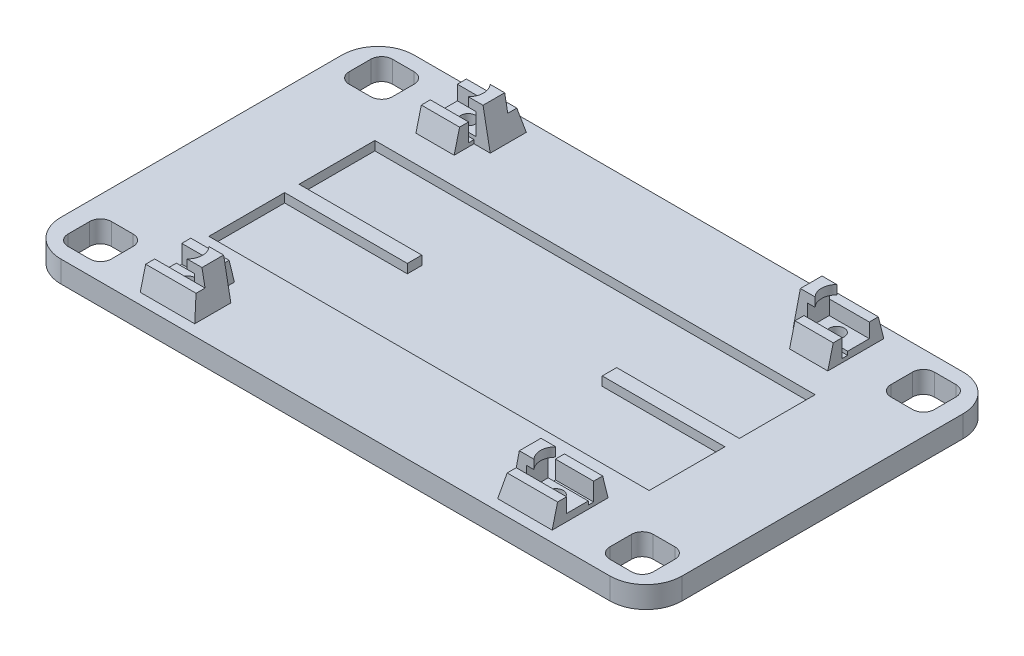
from build123d import *

# Parameters (mm, degrees)
SKETCH1_W                        = 34.5
SKETCH1_H                        = 8.741142107
BOSS_EXTRUDE3_DEPTH              = 6
SKETCH6_W                        = 11
SKETCH6_H                        = 11
BOSS_EXTRUDE4_DEPTH              = 2
CUT_EXTRUDE1_START               = -3
CUT_EXTRUDE1_DEPTH               = 24
SKETCH7_W                        = 11
SKETCH7_H                        = 2.5
SKETCH7_H_2                      = 1
BOSS_EXTRUDE5_DEPTH              = 4
SKETCH10_W                       = 3.083691557
SKETCH10_H                       = 13.597950321
CUT_EXTRUDE2_DEPTH               = 12
SKETCH11_W                       = 10.179154034
SKETCH11_H                       = 1.5
BOSS_EXTRUDE7_DEPTH              = 6
SKETCH12_W                       = 2.5
SKETCH12_H                       = 12.5
BOSS_EXTRUDE8_DEPTH              = 6
BOSS_EXTRUDE9_DEPTH              = 11.6
SKETCH21_R                       = 4.5
CUT_EXTRUDE9_DEPTH               = 3
CUT_EXTRUDE11_DEPTH              = 11.5
BOSS_EXTRUDE14_DEPTH             = 6
CUT_EXTRUDE12_START              = -1
SKETCH28_W                       = 13.111544153
SKETCH28_H                       = 1.5
CUT_EXTRUDE12_DEPTH              = 11
BOSS_EXTRUDE15_DEPTH             = 1.5
SKETCH30_W                       = 2.5
SKETCH30_H                       = 6
BOSS_EXTRUDE16_DEPTH             = 2
SKETCH31_W                       = 2.5
SKETCH31_H                       = 6
BOSS_EXTRUDE17_DEPTH             = 2.5
BOSS_EXTRUDE18_REACH             = 128.051
BOSS_EXTRUDE18_DIRECTION_2_REACH = 128.051
SKETCH34_W                       = 17.603907028
SKETCH34_H                       = 5.411961877
SKETCH34_H_2                     = 6.558600434
CUT_EXTRUDE13_DEPTH              = 4.5
BOSS_EXTRUDE20_DEPTH             = 11.6
MIRROR11_OUTLINE_R               = 2.069860115
MIRROR11_DEPTH                   = 6
MIRROR11_2_OUTLINE_R             = 4.5
MIRROR11_2_OUTLINE_R_2           = 2.069860115
MIRROR11_2_DEPTH                 = 3
MIRROR11_START                   = 6
MIRROR11_3_OUTLINE_R             = 2.069860115
MIRROR11_3_DEPTH                 = 2
MIRROR11_START_2                 = 8
MIRROR11_4_DEPTH                 = 4
MIRROR11_5_OUTLINE_W             = 13.1
MIRROR11_5_OUTLINE_H             = 1.5
MIRROR11_5_DEPTH                 = 1
MIRROR11_START_3                 = 14
MIRROR11_6_DEPTH                 = 2.5
MIRROR11_START_4                 = -59.844904725
MIRROR11_7_OUTLINE_W             = 6
MIRROR11_7_OUTLINE_H             = 2.5
MIRROR11_7_DEPTH                 = 15.1
MIRROR11_START_5                 = -49.244904725
MIRROR11_8_OUTLINE_W             = 10.5
MIRROR11_8_OUTLINE_H             = 6
MIRROR11_8_DEPTH                 = 4.5
MIRROR11_START_6                 = -46.744904725
MIRROR11_9_OUTLINE_W             = 6
MIRROR11_9_OUTLINE_H             = 1.5
MIRROR11_9_DEPTH                 = 2
MIRROR11_10_DEPTH                = 1.5
MIRROR11_START_7                 = -42.831972915
MIRROR11_11_DEPTH                = 2.831972915
BOSS_EXTRUDE21_DEPTH             = 11.6
CUT_EXTRUDE14_START              = -5
SKETCH37_W                       = 89.881860183
SKETCH37_H                       = 1.5
SKETCH37_W_2                     = 87.938782422
CUT_EXTRUDE14_DEPTH              = 5
SKETCH39_W                       = 7.636808492
SKETCH39_H                       = 7.005250269
CUT_EXTRUDE18_DEPTH              = 6
MIRROR13_COPY_1_SKETCH_W         = 7.636808492
MIRROR13_COPY_1_SKETCH_H         = 7.005250269
MIRROR13_COPY_1_DEPTH            = 6
SKETCH41_W                       = 6
SKETCH41_H                       = 6
CUT_EXTRUDE20_DEPTH              = 0.5
SKETCH42_W                       = 122
SKETCH42_H                       = 46
CUT_EXTRUDE21_DEPTH              = 1
SKETCH43_W                       = 24
SKETCH43_H                       = 2
BOSS_EXTRUDE23_DEPTH             = 1
SKETCH44_W                       = 4
SKETCH44_H                       = 17
CUT_EXTRUDE22_DEPTH              = 1.5
SKETCH45_W                       = 16
SKETCH45_H                       = 17
CUT_EXTRUDE23_DEPTH              = 1
SKETCH46_W                       = 58
SKETCH46_H                       = 37
SKETCH46_W_2                     = 54
SKETCH46_H_2                     = 33
BOSS_EXTRUDE25_DEPTH             = 1
SKETCH47_W                       = 54
SKETCH47_H                       = 12
CUT_EXTRUDE24_DEPTH              = 1.5
SKETCH48_W                       = 4
SKETCH48_H                       = 17
CUT_EXTRUDE25_DEPTH              = 1.5
SKETCH49_W                       = 4
SKETCH49_H                       = 17
CUT_EXTRUDE26_DEPTH              = 0.5
SKETCH50_W                       = 4
SKETCH50_H                       = 2
BOSS_EXTRUDE26_DEPTH             = 1
SKETCH51_W                       = 122
SKETCH51_H                       = 46
CUT_EXTRUDE27_DEPTH              = 110
SKETCH52_W                       = 34.00000312
SKETCH52_H                       = 3.99999256
BOSS_EXTRUDE27_DEPTH             = 2.5


with BuildPart() as part:
    # Sketch1 → Boss-Extrude3 (new body)
    # profile 1 of 11: a face of its own
    with BuildSketch(Plane(origin=(0, 0, 0), x_dir=(1, 0, 0), z_dir=(0, 1, 0))):
        with BuildLine():
            Line((73.923306644, 42.779769086), (-59.063365063, 42.779769086))
            ThreePointArc((-59.063365063, 42.779769086), (-65.244285922, 40.219547838), (-67.804507169, 34.03862698))
            Line((-67.804507169, 34.03862698), (-67.804507169, -34.03862698))
            ThreePointArc((-67.804507169, -34.03862698), (-65.244285922, -40.219547838), (-59.063365063, -42.779769086))
            Line((-59.063365063, -42.779769086), (73.923306644, -42.779769086))
            ThreePointArc((73.923306644, -42.779769086), (80.104227503, -40.219547838), (82.664448751, -34.03862698))
            Line((82.664448751, -34.03862698), (82.664448751, 34.03862698))
            ThreePointArc((82.664448751, 34.03862698), (80.104227503, 40.219547838), (73.923306644, 42.779769086))
        make_face()
        with Locations((61.043877697, 34.03862698)):
            Rectangle(SKETCH1_W, SKETCH1_H, mode=Mode.SUBTRACT)
    # profile 2 of 11: a face of its own
    with BuildSketch(Plane(origin=(0, 0, 0), x_dir=(1, 0, 0), z_dir=(0, 1, 0))):
        with BuildLine():
            Line((78.293877697, 29.668055926), (78.293877697, 34.03862698))
            Line((78.293877697, 34.03862698), (74.273170351, 34.03862698))
            ThreePointArc((74.273170351, 34.03862698), (72.293877697, 32.059334326), (70.314585044, 34.03862698))
            Line((70.314585044, 34.03862698), (50.363737812, 34.03862698))
            ThreePointArc((50.363737812, 34.03862698), (48.293877697, 31.968766864), (46.224017582, 34.03862698))
            Line((46.224017582, 34.03862698), (43.793877697, 34.03862698))
            Line((43.793877697, 34.03862698), (43.793877697, 29.668055926))
            Line((43.793877697, 29.668055926), (78.293877697, 29.668055926))
        make_face()
    # profile 3 of 11: a face of its own
    with BuildSketch(Plane(origin=(0, 0, 0), x_dir=(1, 0, 0), z_dir=(0, 1, 0))):
        with BuildLine():
            Line((78.293877697, 34.03862698), (78.293877697, 38.409198033))
            Line((78.293877697, 38.409198033), (43.793877697, 38.409198033))
            Line((43.793877697, 38.409198033), (43.793877697, 34.03862698))
            Line((43.793877697, 34.03862698), (46.224017582, 34.03862698))
            ThreePointArc((46.224017582, 34.03862698), (48.293877697, 36.108487095), (50.363737812, 34.03862698))
            Line((50.363737812, 34.03862698), (70.314585044, 34.03862698))
            ThreePointArc((70.314585044, 34.03862698), (72.293877697, 36.017919633), (74.273170351, 34.03862698))
            Line((74.273170351, 34.03862698), (78.293877697, 34.03862698))
        make_face()
    # profile 4 of 11: a face of its own
    with BuildSketch(Plane(origin=(0, 0, 0), x_dir=(1, 0, 0), z_dir=(0, 1, 0))):
        with BuildLine():
            ThreePointArc((70.314585044, 34.03862698), (72.293877697, 32.059334326), (74.273170351, 34.03862698))
            Line((74.273170351, 34.03862698), (70.314585044, 34.03862698))
        make_face()
    # profile 5 of 11: a face of its own
    with BuildSketch(Plane(origin=(0, 0, 0), x_dir=(1, 0, 0), z_dir=(0, 1, 0))):
        with BuildLine():
            Line((70.314585044, 34.03862698), (74.273170351, 34.03862698))
            ThreePointArc((74.273170351, 34.03862698), (72.293877697, 36.017919633), (70.314585044, 34.03862698))
        make_face()
    # profile 6 of 11: a face of its own
    with BuildSketch(Plane(origin=(0, 0, 0), x_dir=(1, 0, 0), z_dir=(0, 1, 0))):
        with BuildLine():
            ThreePointArc((70.314585044, 34.03862698), (72.293877697, 32.059334326), (74.273170351, 34.03862698))
            Line((74.273170351, 34.03862698), (70.314585044, 34.03862698))
        make_face()
    # profile 7 of 11: a face of its own
    with BuildSketch(Plane(origin=(0, 0, 0), x_dir=(1, 0, 0), z_dir=(0, 1, 0))):
        with BuildLine():
            Line((70.314585044, 34.03862698), (74.273170351, 34.03862698))
            ThreePointArc((74.273170351, 34.03862698), (72.293877697, 36.017919633), (70.314585044, 34.03862698))
        make_face()
    # profile 8 of 11: a face of its own
    with BuildSketch(Plane(origin=(0, 0, 0), x_dir=(1, 0, 0), z_dir=(0, 1, 0))):
        with BuildLine():
            ThreePointArc((50.363737812, 34.03862698), (48.293877697, 36.108487095), (46.224017582, 34.03862698))
            Line((46.224017582, 34.03862698), (50.363737812, 34.03862698))
        make_face()
    # profile 9 of 11: a face of its own
    with BuildSketch(Plane(origin=(0, 0, 0), x_dir=(1, 0, 0), z_dir=(0, 1, 0))):
        with BuildLine():
            Line((50.363737812, 34.03862698), (46.224017582, 34.03862698))
            ThreePointArc((46.224017582, 34.03862698), (48.293877697, 31.968766864), (50.363737812, 34.03862698))
        make_face()
    # profile 10 of 11: a face of its own
    with BuildSketch(Plane(origin=(0, 0, 0), x_dir=(1, 0, 0), z_dir=(0, 1, 0))):
        with BuildLine():
            ThreePointArc((50.363737812, 34.03862698), (48.293877697, 36.108487095), (46.224017582, 34.03862698))
            Line((46.224017582, 34.03862698), (50.363737812, 34.03862698))
        make_face()
    # profile 11 of 11: a face of its own
    with BuildSketch(Plane(origin=(0, 0, 0), x_dir=(1, 0, 0), z_dir=(0, 1, 0))):
        with BuildLine():
            Line((50.363737812, 34.03862698), (46.224017582, 34.03862698))
            ThreePointArc((46.224017582, 34.03862698), (48.293877697, 31.968766864), (50.363737812, 34.03862698))
        make_face()
    extrude(amount=BOSS_EXTRUDE3_DEPTH)

    # Sketch6 → Boss-Extrude4 (add)
    with BuildSketch(Plane(origin=(0, 6, 0), x_dir=(1, 0, 0), z_dir=(0, 1, 0))):
        with Locations((48.114723663, 34.03862698)):
            Rectangle(SKETCH6_W, SKETCH6_H)
    boss_extrude4 = extrude(amount=BOSS_EXTRUDE4_DEPTH)

    # Sketch1<5> → Cut-Extrude1 (cut)
    with BuildSketch(Plane(origin=(0, 0, 0), x_dir=(1, 0, 0), z_dir=(0, 1, 0)).offset(CUT_EXTRUDE1_START)):
        with BuildLine():
            ThreePointArc((50.363737812, 34.03862698), (48.293877697, 36.108487095), (46.224017582, 34.03862698))
            Line((46.224017582, 34.03862698), (50.363737812, 34.03862698))
        make_face()
        with BuildLine():
            Line((50.363737812, 34.03862698), (46.224017582, 34.03862698))
            ThreePointArc((46.224017582, 34.03862698), (48.293877697, 31.968766864), (50.363737812, 34.03862698))
        make_face()
    cut_extrude1 = extrude(amount=CUT_EXTRUDE1_DEPTH, mode=Mode.SUBTRACT)

    # Sketch7 → Boss-Extrude5 (add)
    with BuildSketch(Plane(origin=(0, 8, 0), x_dir=(1, 0, 0), z_dir=(0, 1, 0))):
        with Locations((48.114723663, 38.28862698)):
            Rectangle(SKETCH7_W, SKETCH7_H)
        with Locations((48.114723663, 29.03862698)):
            Rectangle(SKETCH7_W, SKETCH7_H_2)
    boss_extrude5 = extrude(amount=BOSS_EXTRUDE5_DEPTH)

    # Sketch10 → Cut-Extrude2 (cut)
    with BuildSketch(Plane(origin=(0, 6, 0), x_dir=(1, 0, 0), z_dir=(0, 1, 0))):
        with Locations((54.335723476, 34.069991953)):
            Rectangle(SKETCH10_W, SKETCH10_H)
    cut_extrude2 = extrude(amount=CUT_EXTRUDE2_DEPTH, mode=Mode.SUBTRACT)

    # Sketch11 → Boss-Extrude7 (add)
    with BuildSketch(Plane(origin=(0, 6, 0), x_dir=(1, 0, 0), z_dir=(0, 1, 0))):
        with Locations((47.70430068, 27.78862698)):
            Rectangle(SKETCH11_W, SKETCH11_H)
    boss_extrude7 = extrude(amount=BOSS_EXTRUDE7_DEPTH)

    # Sketch12 → Boss-Extrude8 (add)
    with BuildSketch(Plane(origin=(0, 6, 0), x_dir=(1, 0, 0), z_dir=(0, 1, 0))):
        with Locations((42.443877697, 33.28862698)):
            Rectangle(SKETCH12_W, SKETCH12_H)
    boss_extrude8 = extrude(amount=BOSS_EXTRUDE8_DEPTH)

    # Sketch13 → Boss-Extrude9 (add)
    with BuildSketch(Plane.ZY.offset(-41.193877697)):
        Polygon((-27.03862698, 12), (-27.03862698, 6), (-25.53862698, 6), align=None)
        Polygon((-39.53862698, 12), (-39.53862698, 6), (-41.03862698, 6), align=None)
    extrude(amount=-BOSS_EXTRUDE9_DEPTH)

    # Sketch21 → Cut-Extrude9 (cut)
    with BuildSketch(Plane.XZ):
        with Locations(Location((48.293877697, -34.03862698, 0), (0, 0, 270))):
            Circle(SKETCH21_R)
    cut_extrude9 = extrude(amount=-CUT_EXTRUDE9_DEPTH, mode=Mode.SUBTRACT)

    # Sketch24 → Cut-Extrude11 (cut)
    with BuildSketch(Plane(origin=(0, 6, 0), x_dir=(1, 0, 0), z_dir=(0, 1, 0))):
        with BuildLine():
            Line((69.293877697, 40.03862698), (75.293877697, 40.03862698))
            ThreePointArc((75.293877697, 40.03862698), (77.415198041, 39.159947323), (78.293877697, 37.03862698))
            Line((78.293877697, 37.03862698), (78.293877697, 31.03862698))
            ThreePointArc((78.293877697, 31.03862698), (77.415198041, 28.917306636), (75.293877697, 28.03862698))
            Line((75.293877697, 28.03862698), (69.293877697, 28.03862698))
            ThreePointArc((69.293877697, 28.03862698), (67.172557354, 28.917306636), (66.293877697, 31.03862698))
            Line((66.293877697, 31.03862698), (66.293877697, 37.03862698))
            ThreePointArc((66.293877697, 37.03862698), (67.172557354, 39.159947323), (69.293877697, 40.03862698))
        make_face()
    cut_extrude11 = extrude(amount=-CUT_EXTRUDE11_DEPTH, mode=Mode.SUBTRACT)

    # Sketch26 → Boss-Extrude14 (add)
    with BuildSketch(Plane.XZ):
        with BuildLine():
            Line((-78.844904725, 53.842790723), (73.293877697, 53.842790723))
            ThreePointArc((73.293877697, 53.842790723), (80.364945509, 50.913858534), (83.293877697, 43.842790723))
            Line((83.293877697, 43.842790723), (83.293877697, -34.03862698))
            ThreePointArc((83.293877697, -34.03862698), (80.364945509, -41.109694791), (73.293877697, -44.03862698))
            Line((73.293877697, -44.03862698), (-78.844904725, -44.03862698))
            ThreePointArc((-78.844904725, -44.03862698), (-85.915972537, -41.109694791), (-88.844904725, -34.03862698))
            Line((-88.844904725, -34.03862698), (-88.844904725, 43.842790723))
            ThreePointArc((-88.844904725, 43.842790723), (-85.915972537, 50.913858534), (-78.844904725, 53.842790723))
        make_face()
        Polygon((39.621658068, -22.50744652), (81.471959084, -23.594467326), (79.917902441, -39.014138958), (77.090986998, -41.323408937), (59.598365076, -40.869055121), (39.621658068, -40.350179614), align=None, mode=Mode.SUBTRACT)
    extrude(amount=-BOSS_EXTRUDE14_DEPTH)

    # Sketch28 → Cut-Extrude12 (cut)
    with BuildSketch(Plane(origin=(0, 8, 0), x_dir=(1, 0, 0), z_dir=(0, 1, 0)).offset(CUT_EXTRUDE12_START)):
        with Locations((46.238105621, 30.28862698)):
            Rectangle(SKETCH28_W, SKETCH28_H)
    cut_extrude12 = extrude(amount=CUT_EXTRUDE12_DEPTH, mode=Mode.SUBTRACT)

    # Sketch29 → Boss-Extrude15 (add)
    with BuildSketch(Plane(origin=(52.793877697, 0, 0), x_dir=(0, 0, -1), z_dir=(1, 0, 0))):
        Polygon((37.03862698, 8), (31.03862698, 8), (31.03862698, 7), (29.53862698, 7), (29.53862698, 12), (27.03862698, 12), (25.53862698, 6), (41.03862698, 6), (39.53862698, 12), (37.03862698, 12), align=None)
    boss_extrude15 = extrude(amount=BOSS_EXTRUDE15_DEPTH)

    # Sketch30 → Boss-Extrude16 (add)
    with BuildSketch(Plane(origin=(0, 12, 0), x_dir=(1, 0, 0), z_dir=(0, 1, 0))):
        with Locations((42.443877697, 34.03862698)):
            Rectangle(SKETCH30_W, SKETCH30_H)
    boss_extrude16 = extrude(amount=BOSS_EXTRUDE16_DEPTH)

    # Sketch31 → Boss-Extrude17 (add)
    with BuildSketch(Plane(origin=(0, 14, 0), x_dir=(1, 0, 0), z_dir=(0, 1, 0))):
        with Locations((42.443877697, 34.03862698)):
            Rectangle(SKETCH31_W, SKETCH31_H)
        with BuildLine():
            Line((45.283479053, 37.03862698), (43.693877697, 37.03862698))
            Line((43.693877697, 37.03862698), (43.693877697, 31.03862698))
            Line((43.693877697, 31.03862698), (45.283479053, 31.03862698))
            ThreePointArc((45.283479053, 31.03862698), (44.043877697, 34.03862698), (45.283479053, 37.03862698))
        make_face()
    boss_extrude17 = extrude(amount=BOSS_EXTRUDE17_DEPTH)

    # Boss-Extrude18: up to this plane
    boss_extrude18_end = Plane(origin=(58.978536136, 6, -25.53862698), z_dir=(0, 0.2425356250363332, 0.9701425001453319))
    # Sketch33 → Boss-Extrude18 (add, up to the surface)
    with BuildSketch(Plane.XY.offset(-34.03862698), mode=Mode.PRIVATE) as boss_extrude18_sk1:
        Polygon((41.193877697, 16.5), (39.193877697, 6), (41.193877697, 6), align=None)
    boss_extrude18_tool1 = split(extrude(boss_extrude18_sk1.sketch, amount=BOSS_EXTRUDE18_REACH, mode=Mode.PRIVATE), bisect_by=boss_extrude18_end, keep=Keep.BOTH, mode=Mode.PRIVATE)
    boss_extrude18 = boss_extrude18_tool1.solids().sort_by_distance((40.527211, 9.5, -34.038627))[0]
    add(boss_extrude18)

    # Boss-Extrude18 direction 2: up to this plane
    boss_extrude18_direction_2_end = Plane(origin=(58.978536136, 6, -41.03862698), z_dir=(0, 0.2425356250363332, -0.9701425001453319))
    # Sketch33 → Boss-Extrude18 direction 2 (add, up to the surface)
    with BuildSketch(Plane.XY.offset(-34.03862698), mode=Mode.PRIVATE) as boss_extrude18_direction_2_sk1:
        Polygon((41.193877697, 16.5), (39.193877697, 6), (41.193877697, 6), align=None)
    boss_extrude18_direction_2_tool1 = split(extrude(boss_extrude18_direction_2_sk1.sketch, amount=-BOSS_EXTRUDE18_DIRECTION_2_REACH, mode=Mode.PRIVATE), bisect_by=boss_extrude18_direction_2_end, keep=Keep.BOTH, mode=Mode.PRIVATE)
    boss_extrude18_direction_2 = boss_extrude18_direction_2_tool1.solids().sort_by_distance((40.527211, 9.5, -34.038627))[0]
    add(boss_extrude18_direction_2)
    boss_extrude18 = boss_extrude18 + boss_extrude18_direction_2  # both directions under the feature's name, for the pattern or mirror that repeats it

    # Sketch34 → Cut-Extrude13 (cut)
    with BuildSketch(Plane(origin=(0, 16.5, 0), x_dir=(1, 0, 0), z_dir=(0, 1, 0))):
        with Locations((45.491924183, 39.744607919)):
            Rectangle(SKETCH34_W, SKETCH34_H)
        with Locations((45.491924183, 27.759326763)):
            Rectangle(SKETCH34_W, SKETCH34_H_2)
    cut_extrude13 = extrude(amount=-CUT_EXTRUDE13_DEPTH, mode=Mode.SUBTRACT)

    # Mirror9: Boss-Extrude4, Cut-Extrude1, Boss-Extrude5, Cut-Extrude2, Boss-Extrude7, Boss-Extrude8, Cut-Extrude9, Cut-Extrude11, Cut-Extrude12, Boss-Extrude15, Boss-Extrude16, Boss-Extrude17, Boss-Extrude18, Cut-Extrude13 across plane
    add(boss_extrude4.mirror(Plane.XY.offset(4.902081871)))
    add(cut_extrude1.mirror(Plane.XY.offset(4.902081871)), mode=Mode.SUBTRACT)
    add(boss_extrude5.mirror(Plane.XY.offset(4.902081871)))
    add(cut_extrude2.mirror(Plane.XY.offset(4.902081871)), mode=Mode.SUBTRACT)
    add(boss_extrude7.mirror(Plane.XY.offset(4.902081871)))
    add(boss_extrude8.mirror(Plane.XY.offset(4.902081871)))
    add(cut_extrude9.mirror(Plane.XY.offset(4.902081871)), mode=Mode.SUBTRACT)
    add(cut_extrude11.mirror(Plane.XY.offset(4.902081871)), mode=Mode.SUBTRACT)
    add(cut_extrude12.mirror(Plane.XY.offset(4.902081871)), mode=Mode.SUBTRACT)
    add(boss_extrude15.mirror(Plane.XY.offset(4.902081871)))
    add(boss_extrude16.mirror(Plane.XY.offset(4.902081871)))
    add(boss_extrude17.mirror(Plane.XY.offset(4.902081871)))
    add(boss_extrude18.mirror(Plane.XY.offset(4.902081871)))
    add(cut_extrude13.mirror(Plane.XY.offset(4.902081871)), mode=Mode.SUBTRACT)

    # Sketch35 → Boss-Extrude20 (add)
    with BuildSketch(Plane.ZY.offset(-52.793877697)):
        Polygon((35.342790723, 6), (36.842790723, 6), (36.842790723, 12), align=None)
        Polygon((50.842790723, 6), (49.342790723, 12), (49.342790723, 6), align=None)
    extrude(amount=BOSS_EXTRUDE20_DEPTH)

    # Mirror11: read off the stored shape, not the designer's step
    # Mirror11 outline → Mirror11 (cut)
    with BuildSketch(Plane(origin=(0, 0, 0), x_dir=(1, 0, 0), z_dir=(0, 1, 0))):
        with Locations((-53.844904725, 34.03862698)):
            Circle(MIRROR11_OUTLINE_R)
        with Locations((-53.844904725, -43.842790723)):
            Circle(MIRROR11_OUTLINE_R)
        with BuildLine():
            Line((-74.844904725, 40.03862698), (-80.844904725, 40.03862698))
            ThreePointArc((-80.844904725, 40.03862698), (-82.966225069, 39.159947323), (-83.844904725, 37.03862698))
            Line((-83.844904725, 37.03862698), (-83.844904725, 31.03862698))
            ThreePointArc((-83.844904725, 31.03862698), (-82.966225069, 28.917306636), (-80.844904725, 28.03862698))
            Line((-80.844904725, 28.03862698), (-74.844904725, 28.03862698))
            ThreePointArc((-74.844904725, 28.03862698), (-72.723584382, 28.917306636), (-71.844904725, 31.03862698))
            Line((-71.844904725, 31.03862698), (-71.844904725, 37.03862698))
            ThreePointArc((-71.844904725, 37.03862698), (-72.723584382, 39.159947323), (-74.844904725, 40.03862698))
        make_face()
        with BuildLine():
            ThreePointArc((-71.844904725, -40.842790723), (-72.723584382, -38.721470379), (-74.844904725, -37.842790723))
            Line((-74.844904725, -37.842790723), (-80.844904725, -37.842790723))
            ThreePointArc((-80.844904725, -37.842790723), (-82.966225069, -38.721470379), (-83.844904725, -40.842790723))
            Line((-83.844904725, -40.842790723), (-83.844904725, -46.842790723))
            ThreePointArc((-83.844904725, -46.842790723), (-82.966225069, -48.964111066), (-80.844904725, -49.842790723))
            Line((-80.844904725, -49.842790723), (-74.844904725, -49.842790723))
            ThreePointArc((-74.844904725, -49.842790723), (-72.723584382, -48.964111066), (-71.844904725, -46.842790723))
            Line((-71.844904725, -46.842790723), (-71.844904725, -40.842790723))
        make_face()
    extrude(amount=MIRROR11_DEPTH, mode=Mode.SUBTRACT)

    # Mirror11 2 outline → Mirror11 2 (cut)
    # profile 1 of 2: a face of its own
    with BuildSketch(Plane(origin=(0, 0, 0), x_dir=(1, 0, 0), z_dir=(0, 1, 0))):
        with Locations((-53.844904725, -43.842790723)):
            Circle(MIRROR11_2_OUTLINE_R)
        with Locations((-53.844904725, -43.842790723)):
            Circle(MIRROR11_2_OUTLINE_R_2, mode=Mode.SUBTRACT)
    # profile 2 of 2: a face of its own
    with BuildSketch(Plane(origin=(0, 0, 0), x_dir=(1, 0, 0), z_dir=(0, 1, 0))):
        with Locations((-53.844904725, 34.03862698)):
            Circle(MIRROR11_2_OUTLINE_R)
        with Locations((-53.844904725, 34.03862698)):
            Circle(MIRROR11_2_OUTLINE_R_2, mode=Mode.SUBTRACT)
    extrude(amount=MIRROR11_2_DEPTH, mode=Mode.SUBTRACT)

    # Mirror11 3 outline → Mirror11 3 (add)
    # profile 1 of 2: a face of its own
    with BuildSketch(Plane(origin=(0, 0, 0), x_dir=(1, 0, 0), z_dir=(0, 1, 0)).offset(MIRROR11_START)):
        with BuildLine():
            Line((-50.490802759, -46.842790723), (-49.244904725, -46.842790723))
            Line((-49.244904725, -46.842790723), (-49.244904725, -40.842790723))
            Line((-49.244904725, -40.842790723), (-59.844904725, -40.842790723))
            Line((-59.844904725, -40.842790723), (-59.844904725, -46.842790723))
            Line((-59.844904725, -46.842790723), (-57.199006691, -46.842790723))
            ThreePointArc((-57.199006691, -46.842790723), (-53.844904725, -48.342790723), (-50.490802759, -46.842790723))
        make_face()
        with Locations((-53.844904725, -43.842790723)):
            Circle(MIRROR11_3_OUTLINE_R, mode=Mode.SUBTRACT)
    # profile 2 of 2: a face of its own
    with BuildSketch(Plane(origin=(0, 0, 0), x_dir=(1, 0, 0), z_dir=(0, 1, 0)).offset(MIRROR11_START)):
        with BuildLine():
            Line((-49.244904725, 31.03862698), (-49.244904725, 37.03862698))
            Line((-49.244904725, 37.03862698), (-50.490802759, 37.03862698))
            ThreePointArc((-50.490802759, 37.03862698), (-53.844904725, 38.53862698), (-57.199006691, 37.03862698))
            Line((-57.199006691, 37.03862698), (-59.844904725, 37.03862698))
            Line((-59.844904725, 37.03862698), (-59.844904725, 31.03862698))
            Line((-59.844904725, 31.03862698), (-49.244904725, 31.03862698))
        make_face()
        with Locations((-53.844904725, 34.03862698)):
            Circle(MIRROR11_3_OUTLINE_R, mode=Mode.SUBTRACT)
    extrude(amount=MIRROR11_3_DEPTH)

    # Mirror11 4 outline → Mirror11 4 (add)
    with BuildSketch(Plane(origin=(0, 0, 0), x_dir=(1, 0, 0), z_dir=(0, 1, 0)).offset(MIRROR11_START_2)):
        with BuildLine():
            ThreePointArc((-57.199006691, -46.842790723), (-53.844904725, -48.342790723), (-50.490802759, -46.842790723))
            Line((-50.490802759, -46.842790723), (-57.199006691, -46.842790723))
        make_face()
        with BuildLine():
            Line((-57.199006691, 37.03862698), (-50.490802759, 37.03862698))
            ThreePointArc((-50.490802759, 37.03862698), (-53.844904725, 38.53862698), (-57.199006691, 37.03862698))
        make_face()
    extrude(amount=MIRROR11_4_DEPTH)

    # Mirror11 5 outline → Mirror11 5 (add)
    with BuildSketch(Plane(origin=(0, 0, 0), x_dir=(1, 0, 0), z_dir=(0, 1, 0)).offset(MIRROR11_START)):
        with Locations((-53.294904725, -40.092790723)):
            Rectangle(MIRROR11_5_OUTLINE_W, MIRROR11_5_OUTLINE_H)
        with Locations((-53.294904725, 30.28862698)):
            Rectangle(MIRROR11_5_OUTLINE_W, MIRROR11_5_OUTLINE_H)
    extrude(amount=MIRROR11_5_DEPTH)

    # Mirror11 7 outline → Mirror11 7 (add)
    with BuildSketch(Plane.YZ.offset(MIRROR11_START_4)):
        Polygon((6, 39.342790723), (6, 35.342790723), (12, 36.842790723), (12, 39.342790723), align=None)
        with Locations((9, -28.28862698)):
            Rectangle(MIRROR11_7_OUTLINE_W, MIRROR11_7_OUTLINE_H)
        with Locations((9, -38.28862698)):
            Rectangle(MIRROR11_7_OUTLINE_W, MIRROR11_7_OUTLINE_H)
        Polygon((6, 50.842790723), (6, 46.842790723), (12, 46.842790723), (12, 49.342790723), align=None)
    extrude(amount=MIRROR11_7_DEPTH)



with BuildPart() as body_2:
    # Mirror11 6 outline → Mirror11 6 (new body)
    with BuildSketch(Plane(origin=(0, 0, 0), x_dir=(1, 0, 0), z_dir=(0, 1, 0)).offset(MIRROR11_START_3)):
        with BuildLine():
            Line((-49.244904725, -46.842790723), (-49.244904725, -40.842790723))
            Line((-49.244904725, -40.842790723), (-50.834506081, -40.842790723))
            ThreePointArc((-50.834506081, -40.842790723), (-49.594904725, -43.842790723), (-50.834506081, -46.842790723))
            Line((-50.834506081, -46.842790723), (-49.244904725, -46.842790723))
        make_face()
        with BuildLine():
            Line((-49.244904725, 31.03862698), (-49.244904725, 37.03862698))
            Line((-49.244904725, 37.03862698), (-50.834506081, 37.03862698))
            ThreePointArc((-50.834506081, 37.03862698), (-49.594904725, 34.03862698), (-50.834506081, 31.03862698))
            Line((-50.834506081, 31.03862698), (-49.244904725, 31.03862698))
        make_face()
    extrude(amount=MIRROR11_6_DEPTH)


with BuildPart() as part_1:
    add(part.part)

    add(body_2.part)  # Mirror11 8 merges body 2
    # Mirror11 8 outline → Mirror11 8 (add)
    with BuildSketch(Plane.YZ.offset(MIRROR11_START_5)):
        with Locations((11.25, -34.03862698)):
            Rectangle(MIRROR11_8_OUTLINE_W, MIRROR11_8_OUTLINE_H)
        with Locations((11.25, 43.842790723)):
            Rectangle(MIRROR11_8_OUTLINE_W, MIRROR11_8_OUTLINE_H)
    extrude(amount=MIRROR11_8_DEPTH)

    # Mirror11 9 outline → Mirror11 9 (add)
    with BuildSketch(Plane.YZ.offset(MIRROR11_START_6)):
        with Locations((9, -30.28862698)):
            Rectangle(MIRROR11_9_OUTLINE_W, MIRROR11_9_OUTLINE_H)
        Polygon((6, -27.03862698), (12, -27.03862698), (6, -25.53862698), align=None)
        with Locations((9, 40.092790723)):
            Rectangle(MIRROR11_9_OUTLINE_W, MIRROR11_9_OUTLINE_H)
        Polygon((12, -39.53862698), (6, -39.53862698), (6, -41.03862698), align=None)
    extrude(amount=MIRROR11_9_DEPTH)

    # Mirror11 10 outline → Mirror11 10 (add)
    with BuildSketch(Plane.YZ.offset(MIRROR11_START_4)):
        Polygon((6, -27.03862698), (12, -27.03862698), (6, -25.53862698), align=None)
        Polygon((12, -39.53862698), (6, -39.53862698), (6, -41.03862698), align=None)
    extrude(amount=MIRROR11_10_DEPTH)

    # Mirror11 11 outline → Mirror11 11 (cut)
    with BuildSketch(Plane(origin=(0, 0, 0), x_dir=(-0.18711210788999502, 0.9823385664224749, 0), z_dir=(0.9823385664224749, 0.187112107889995, 0)).offset(MIRROR11_START_7)):
        Polygon((14.266344839, -41.03862698), (20.374218647, -39.53862698), (20.374218647, -37.03862698), (24.955124002, -37.03862698), (24.955124002, -31.03862698), (20.374218647, -31.03862698), (20.374218647, -27.03862698), (14.266344839, -25.53862698), align=None)
        Polygon((24.955124002, 40.842790723), (24.955124002, 46.842790723), (20.374218647, 46.842790723), (20.374218647, 49.342790723), (14.266344839, 50.842790723), (14.266344839, 35.342790723), (20.374218647, 36.842790723), (20.374218647, 40.842790723), align=None)
    extrude(amount=MIRROR11_11_DEPTH, mode=Mode.SUBTRACT)

    # Sketch36 → Boss-Extrude21 (add)
    with BuildSketch(Plane(origin=(-58.344904725, 0, 0), x_dir=(0, 0, -1), z_dir=(1, 0, 0))):
        Polygon((41.03862698, 6), (39.53862698, 12), (39.53862698, 6), align=None)
        Polygon((25.53862698, 6), (27.03862698, 6), (27.03862698, 12), align=None)
    extrude(amount=BOSS_EXTRUDE21_DEPTH)

    # Sketch37 → Cut-Extrude14 (cut)
    with BuildSketch(Plane(origin=(0, 12, 0), x_dir=(1, 0, 0), z_dir=(0, 1, 0)).offset(CUT_EXTRUDE14_START)):
        with Locations((-3.747052394, -40.092790723)):
            Rectangle(SKETCH37_W, SKETCH37_H)
        with Locations((-2.775513514, 30.28862698)):
            Rectangle(SKETCH37_W_2, SKETCH37_H)
    extrude(amount=CUT_EXTRUDE14_DEPTH, mode=Mode.SUBTRACT)

    # Sketch39 → Cut-Extrude18 (cut)
    with BuildSketch(Plane(origin=(0, 12, 0), x_dir=(1, 0, 0), z_dir=(0, 1, 0))):
        with Locations((-45.426500479, -37.340165588)):
            Rectangle(SKETCH39_W, SKETCH39_H)
    cut_extrude18 = extrude(amount=-CUT_EXTRUDE18_DEPTH, mode=Mode.SUBTRACT)

    # Mirror12: Cut-Extrude18 across plane
    add(cut_extrude18.mirror(Plane.XY.offset(4.902081871)), mode=Mode.SUBTRACT)

    # Mirror13: Cut-Extrude18 across plane
    add(cut_extrude18.mirror(Plane.ZY.offset(2.775513514)), mode=Mode.SUBTRACT)

    # Mirror13 copy 1 sketch → Mirror13 copy 1 (cut)
    with BuildSketch(Plane(origin=(-5.551027028, 12, 9.804163743), x_dir=(-1, 0, 0), z_dir=(0, 1, 0))):
        with Locations((-45.426500479, -37.340165588)):
            Rectangle(MIRROR13_COPY_1_SKETCH_W, MIRROR13_COPY_1_SKETCH_H)
    extrude(amount=-MIRROR13_COPY_1_DEPTH, mode=Mode.SUBTRACT)

    # Sketch41 → Cut-Extrude20 (cut)
    with BuildSketch(Plane(origin=(43.693877697, 0, 0), x_dir=(0, 0, -1), z_dir=(1, 0, 0))):
        with Locations((34.03862698, 11)):
            Rectangle(SKETCH41_W, SKETCH41_H)
        with Locations((-43.842790723, 11)):
            Rectangle(SKETCH41_W, SKETCH41_H)
    cut_extrude20 = extrude(amount=-CUT_EXTRUDE20_DEPTH, mode=Mode.SUBTRACT)

    # Mirror14: Cut-Extrude20 across plane
    add(cut_extrude20.mirror(Plane.ZY.offset(2.775513514)), mode=Mode.SUBTRACT)

    # Sketch42 → Cut-Extrude21 (cut)
    with BuildSketch(Plane(origin=(0, 6, 0), x_dir=(1, 0, 0), z_dir=(0, 1, 0))):
        with Locations((-2.775513514, -4.902081871)):
            Rectangle(SKETCH42_W, SKETCH42_H)
    extrude(amount=-CUT_EXTRUDE21_DEPTH, mode=Mode.SUBTRACT)

    # Sketch43 → Boss-Extrude23 (add)
    with BuildSketch(Plane(origin=(0, 5, 0), x_dir=(1, 0, 0), z_dir=(0, 1, 0))):
        with Locations((-51.775513514, -9.902081871)):
            Rectangle(SKETCH43_W, SKETCH43_H)
        with Locations((-51.775513514, 0.097918129)):
            Rectangle(SKETCH43_W, SKETCH43_H)
        with Locations((46.224486486, 0.097918129)):
            Rectangle(SKETCH43_W, SKETCH43_H)
        with Locations((46.224486486, -9.902081871)):
            Rectangle(SKETCH43_W, SKETCH43_H)
    extrude(amount=BOSS_EXTRUDE23_DEPTH)

    # Sketch44 → Cut-Extrude22 (cut)
    with BuildSketch(Plane(origin=(0, 5, 0), x_dir=(1, 0, 0), z_dir=(0, 1, 0))):
        with Locations((-61.775513514, -19.402081871)):
            Rectangle(SKETCH44_W, SKETCH44_H)
        with Locations((-41.775513514, -19.402081871)):
            Rectangle(SKETCH44_W, SKETCH44_H)
        with Locations((-61.775513514, 9.597918129)):
            Rectangle(SKETCH44_W, SKETCH44_H)
        with Locations((-41.775513514, 9.597918129)):
            Rectangle(SKETCH44_W, SKETCH44_H)
        with Locations((36.224486486, 9.597918129)):
            Rectangle(SKETCH44_W, SKETCH44_H)
        with Locations((56.224486486, 9.597918129)):
            Rectangle(SKETCH44_W, SKETCH44_H)
        with Locations((36.224486486, -19.402081871)):
            Rectangle(SKETCH44_W, SKETCH44_H)
        with Locations((56.224486486, -19.402081871)):
            Rectangle(SKETCH44_W, SKETCH44_H)
    extrude(amount=-CUT_EXTRUDE22_DEPTH, mode=Mode.SUBTRACT)

    # Sketch45 → Cut-Extrude23 (cut)
    with BuildSketch(Plane(origin=(0, 5, 0), x_dir=(1, 0, 0), z_dir=(0, 1, 0))):
        with Locations((-51.775513514, 9.597918129)):
            Rectangle(SKETCH45_W, SKETCH45_H)
        with Locations((-51.775513514, -19.402081871)):
            Rectangle(SKETCH45_W, SKETCH45_H)
        with Locations((46.224486486, 9.597918129)):
            Rectangle(SKETCH45_W, SKETCH45_H)
        with Locations((46.224486486, -19.402081871)):
            Rectangle(SKETCH45_W, SKETCH45_H)
    extrude(amount=-CUT_EXTRUDE23_DEPTH, mode=Mode.SUBTRACT)

    # Sketch46 → Boss-Extrude25 (add)
    with BuildSketch(Plane(origin=(0, 5, 0), x_dir=(1, 0, 0), z_dir=(0, 1, 0))):
        with Locations((-2.775513514, -4.902081871)):
            Rectangle(SKETCH46_W, SKETCH46_H)
        with Locations((-2.775513514, -4.902081871)):
            Rectangle(SKETCH46_W_2, SKETCH46_H_2, mode=Mode.SUBTRACT)
    extrude(amount=BOSS_EXTRUDE25_DEPTH)

    # Sketch47 → Cut-Extrude24 (cut)
    with BuildSketch(Plane(origin=(0, 5, 0), x_dir=(1, 0, 0), z_dir=(0, 1, 0))):
        with Locations((-2.775513514, 5.597918129)):
            Rectangle(SKETCH47_W, SKETCH47_H)
        with Locations((-2.775513514, -15.402081871)):
            Rectangle(SKETCH47_W, SKETCH47_H)
    extrude(amount=-CUT_EXTRUDE24_DEPTH, mode=Mode.SUBTRACT)

    # Sketch48 → Cut-Extrude25 (cut)
    with BuildSketch(Plane(origin=(0, 5, 0), x_dir=(1, 0, 0), z_dir=(0, 1, 0))):
        with Locations((-37.775513514, 9.597918129)):
            Rectangle(SKETCH48_W, SKETCH48_H)
        with Locations((-37.775513514, -19.402081871)):
            Rectangle(SKETCH48_W, SKETCH48_H)
        with Locations((32.224486486, 9.597918129)):
            Rectangle(SKETCH48_W, SKETCH48_H)
        with Locations((32.224486486, -19.402081871)):
            Rectangle(SKETCH48_W, SKETCH48_H)
    extrude(amount=-CUT_EXTRUDE25_DEPTH, mode=Mode.SUBTRACT)

    # Sketch49 → Cut-Extrude26 (cut)
    with BuildSketch(Plane(origin=(0, 4, 0), x_dir=(1, 0, 0), z_dir=(0, 1, 0))):
        with Locations((-57.775513514, 9.597918129)):
            Rectangle(SKETCH49_W, SKETCH49_H)
        with Locations((-57.775513514, -19.402081871)):
            Rectangle(SKETCH49_W, SKETCH49_H)
        with Locations((52.224486486, 9.597918129)):
            Rectangle(SKETCH49_W, SKETCH49_H)
        with Locations((52.224486486, -19.402081871)):
            Rectangle(SKETCH49_W, SKETCH49_H)
    extrude(amount=-CUT_EXTRUDE26_DEPTH, mode=Mode.SUBTRACT)

    # Sketch50 → Boss-Extrude26 (add)
    with BuildSketch(Plane(origin=(0, 5, 0), x_dir=(1, 0, 0), z_dir=(0, 1, 0))):
        with Locations((-37.775513514, 0.097918129)):
            Rectangle(SKETCH50_W, SKETCH50_H)
        with Locations((-37.775513514, -9.902081871)):
            Rectangle(SKETCH50_W, SKETCH50_H)
        with Locations((32.224486486, 0.097918129)):
            Rectangle(SKETCH50_W, SKETCH50_H)
        with Locations((32.224486486, -9.902081871)):
            Rectangle(SKETCH50_W, SKETCH50_H)
    extrude(amount=BOSS_EXTRUDE26_DEPTH)

    # Sketch51 → Cut-Extrude27 (cut)
    with BuildSketch(Plane(origin=(0, 3.5, 0), x_dir=(1, 0, 0), z_dir=(0, 1, 0))):
        with Locations((-2.775513514, -4.902081871)):
            Rectangle(SKETCH51_W, SKETCH51_H)
    extrude(amount=CUT_EXTRUDE27_DEPTH, mode=Mode.SUBTRACT)

    # Sketch52 → Boss-Extrude27 (add)
    with BuildSketch(Plane(origin=(0, 3.5, 0), x_dir=(1, 0, 0), z_dir=(0, 1, 0))):
        with Locations((-46.775511954, -4.902081871)):
            Rectangle(SKETCH52_W, SKETCH52_H)
        with Locations((41.224484926, -4.902081871)):
            Rectangle(SKETCH52_W, SKETCH52_H)
    extrude(amount=BOSS_EXTRUDE27_DEPTH)


solid = part_1.part
